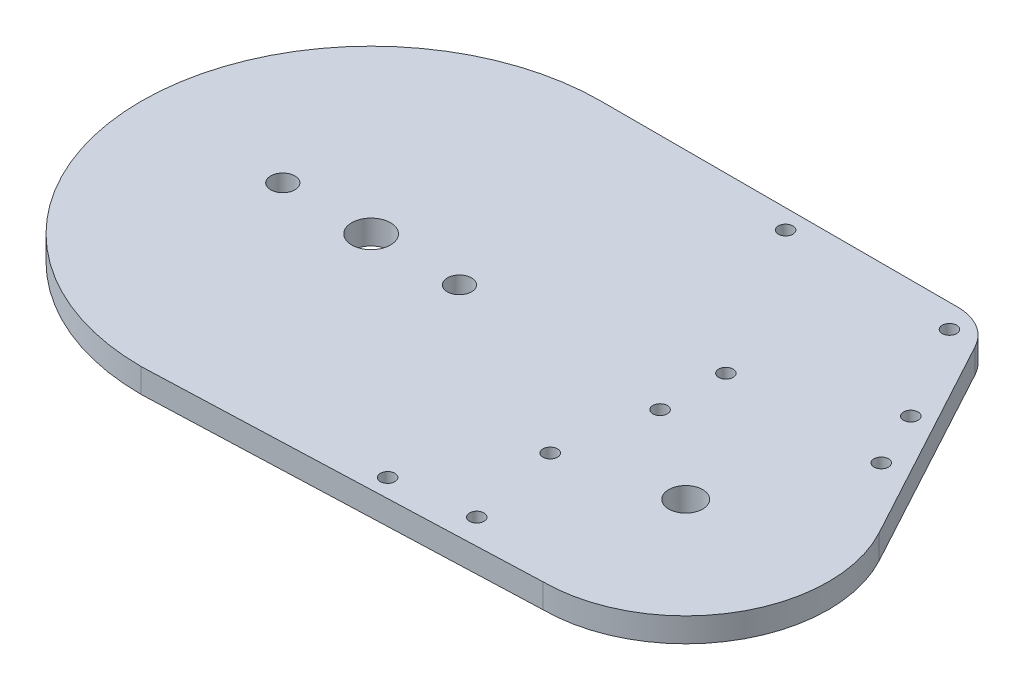
from build123d import *

# Parameters (mm, degrees)
SKETCH1_R           = 4
SKETCH1_R_2         = 1.5
SKETCH1_R_3         = 2.5
SKETCH1_R_4         = 3.5
BOSS_EXTRUDE1_DEPTH = 5


with BuildPart() as part:
    # Sketch1 → Boss-Extrude1 (new body)
    with BuildSketch(Plane(origin=(0, 0, 0), x_dir=(1, 0, 0), z_dir=(0, 1, 0))):
        with BuildLine():
            Line((0, -47.5), (80, -44.5))
            ThreePointArc((80, -44.5), (105.341650726, -30.101348895), (105.945295539, -0.961067014))
            Line((105.945295539, -0.961067014), (82.559049402, 42.258960334))
            ThreePointArc((82.559049402, 42.258960334), (78.883135286, 46.090390077), (73.764033965, 47.5))
            Line((73.764033965, 47.5), (0, 47.5))
            ThreePointArc((0, 47.5), (-47.5, 0), (0, -47.5))
        make_face()
        Circle(SKETCH1_R, mode=Mode.SUBTRACT)
        with Locations((61.303276624, -1.604757001)):
            Circle(SKETCH1_R_2, mode=Mode.SUBTRACT)
        with Locations((57.720626408, -20.712224818)):
            Circle(SKETCH1_R_2, mode=Mode.SUBTRACT)
        with Locations((18.25, 0)):
            Circle(SKETCH1_R_3, mode=Mode.SUBTRACT)
        with Locations((-18.25, 0)):
            Circle(SKETCH1_R_3, mode=Mode.SUBTRACT)
        with Locations((80, -15)):
            Circle(SKETCH1_R_4, mode=Mode.SUBTRACT)
        with Locations((76.835494757, 42.654234046)):
            Circle(SKETCH1_R_2, mode=Mode.SUBTRACT)
        with Locations((88.354686129, 23.142870245)):
            Circle(SKETCH1_R_2, mode=Mode.SUBTRACT)
        with Locations((42.137334928, 43.5)):
            Circle(SKETCH1_R_2, mode=Mode.SUBTRACT)
        with Locations((45.293422434, -41.885064382)):
            Circle(SKETCH1_R_2, mode=Mode.SUBTRACT)
        with Locations((61.591696316, 11.71100727)):
            Circle(SKETCH1_R_2, mode=Mode.SUBTRACT)
        with Locations((93.688017257, 11.71100727)):
            Circle(SKETCH1_R_2, mode=Mode.SUBTRACT)
        with Locations((61.591696316, -39.768646015)):
            Circle(SKETCH1_R_2, mode=Mode.SUBTRACT)
    extrude(amount=BOSS_EXTRUDE1_DEPTH)


solid = part.part
